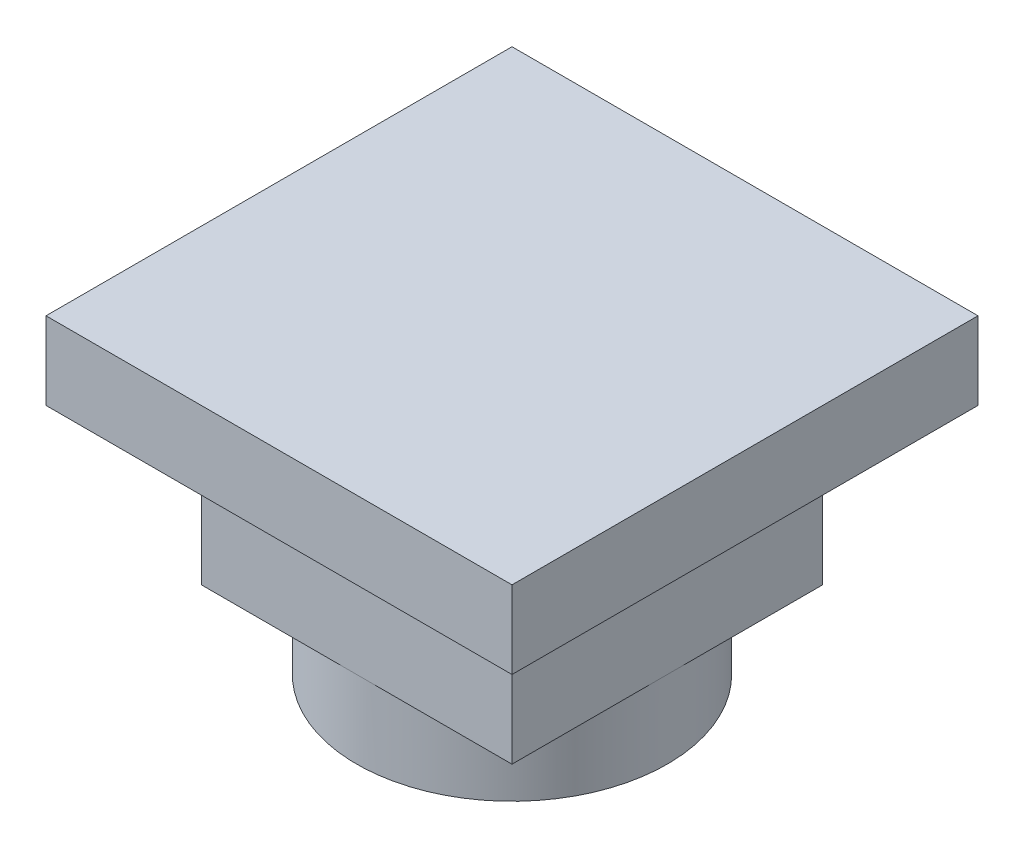
from build123d import *

# Parameters (mm, degrees)
SKETCH1_W           = 1
SKETCH1_H           = 1
BOSS_EXTRUDE1_DEPTH = 0.5
SKETCH2_W           = 1.5
SKETCH2_H           = 1.5
BOSS_EXTRUDE2_DEPTH = 0.25
SKETCH3_R           = 0.5
BOSS_EXTRUDE3_DEPTH = 0.25


with BuildPart() as part:
    # Sketch1 → Boss-Extrude1 (new body)
    with BuildSketch(Plane(origin=(0, 0, 0), x_dir=(1, 0, 0), z_dir=(0, 1, 0))):
        Rectangle(SKETCH1_W, SKETCH1_H)
    extrude(amount=BOSS_EXTRUDE1_DEPTH)

    # Sketch2 → Boss-Extrude2 (add)
    with BuildSketch(Plane(origin=(0, 0.5, 0), x_dir=(1, 0, 0), z_dir=(0, 1, 0))):
        Rectangle(SKETCH2_W, SKETCH2_H)
    extrude(amount=BOSS_EXTRUDE2_DEPTH)

    # Sketch3 → Boss-Extrude3 (add)
    with BuildSketch(Plane.XZ):
        Circle(SKETCH3_R)
    extrude(amount=BOSS_EXTRUDE3_DEPTH)


solid = part.part
